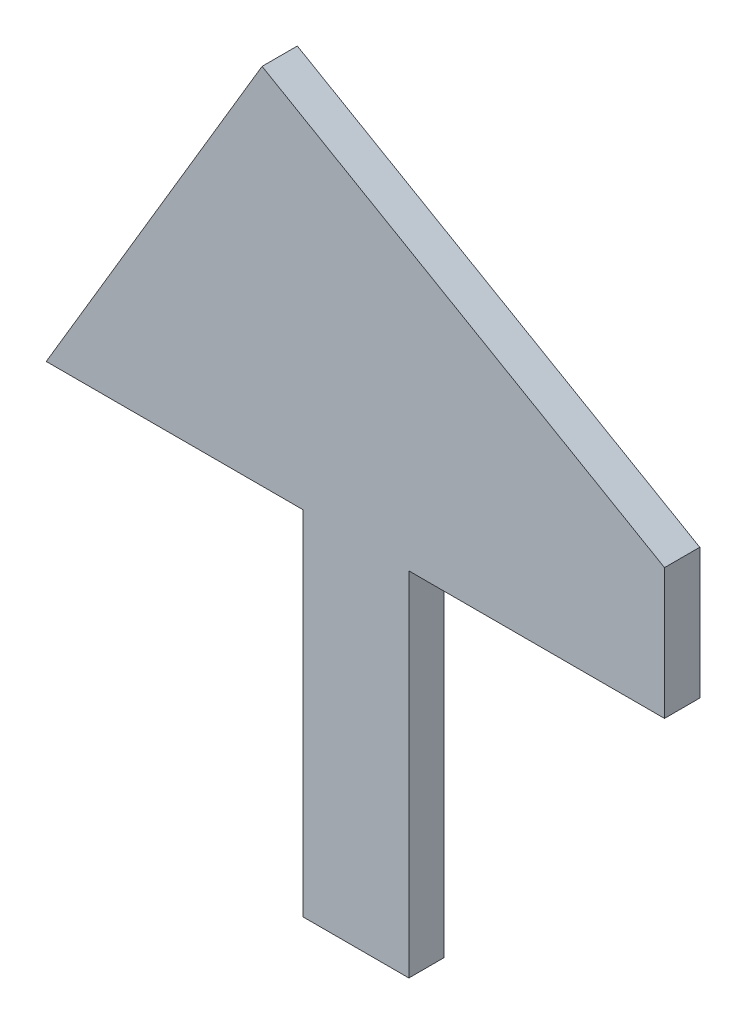
from build123d import *

# Parameters (mm, degrees)
BOSS_EXTRUDE1_DEPTH = 1


with BuildPart() as part:
    # Sketch1 → Boss-Extrude1 (new body)
    with BuildSketch(Plane.XY):
        Polygon((36.5, 3.704235511), (36.5, 0), (29.25, 0), (29.25, -10), (26.25, -10), (26.25, 0), (18.965335593, 0), (25.086453007, 10.309107996), align=None)
    extrude(amount=BOSS_EXTRUDE1_DEPTH)


solid = part.part
